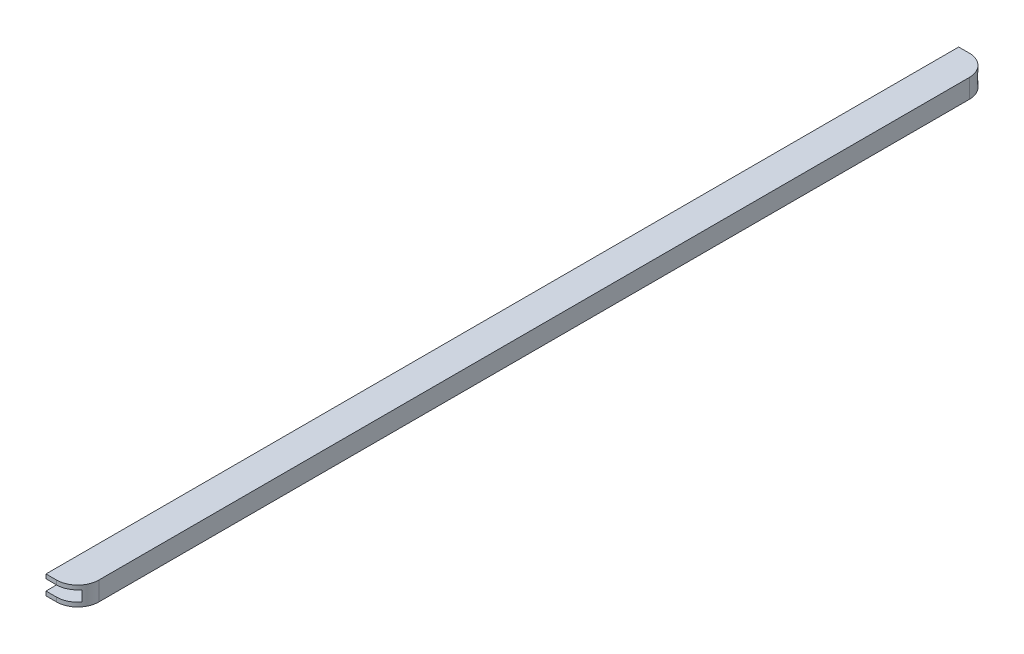
from build123d import *

# Parameters (mm, degrees)
SKETCH2_W           = 15
SKETCH2_H           = 432
BOSS_EXTRUDE1_DEPTH = 9
SKETCH3_W           = 432
SKETCH3_H           = 5
CUT_EXTRUDE1_DEPTH  = 13
FILLET1_R           = 10
FILLET2_R           = 10


with BuildPart() as part:
    # Sketch2 → Boss-Extrude1 (new body)
    with BuildSketch(Plane(origin=(0, 0, 0), x_dir=(1, 0, 0), z_dir=(0, 1, 0))):
        with Locations((-75.63559322, -170.618644068)):
            Rectangle(SKETCH2_W, SKETCH2_H)
    extrude(amount=BOSS_EXTRUDE1_DEPTH)

    # Sketch3 → Cut-Extrude1 (cut)
    with BuildSketch(Plane.ZY.offset(83.13559322)):
        with Locations((170.618644068, 4.5)):
            Rectangle(SKETCH3_W, SKETCH3_H)
    extrude(amount=-CUT_EXTRUDE1_DEPTH, mode=Mode.SUBTRACT)

    # Fillet1
    # the kernel refuses this fillet: 10 mm, written as the material it takes off along each edge
    with BuildSketch(Plane(origin=(-68.13559322, -25, 386.618644068), x_dir=(0, 0, -1), z_dir=(0, 1, 0))) as fillet1_piece_1:
        with BuildLine():
            CenterArc((FILLET1_R, FILLET1_R), FILLET1_R, 180, 90)
            Line((0, FILLET1_R), (0, 0))
            Line((0, 0), (FILLET1_R, 0))
        make_face()
    extrude(amount=59, mode=Mode.SUBTRACT)

    # Fillet2
    # the kernel refuses this fillet: 10 mm, written as the material it takes off along each edge
    with BuildSketch(Plane(origin=(-68.13559322, -25, -45.381355932), x_dir=(-1, 0, 0), z_dir=(0, 1, 0))) as fillet2_piece_1:
        with BuildLine():
            CenterArc((FILLET2_R, FILLET2_R), FILLET2_R, 180, 90)
            Line((0, FILLET2_R), (0, 0))
            Line((0, 0), (FILLET2_R, 0))
        make_face()
    extrude(amount=59, mode=Mode.SUBTRACT)


solid = part.part
